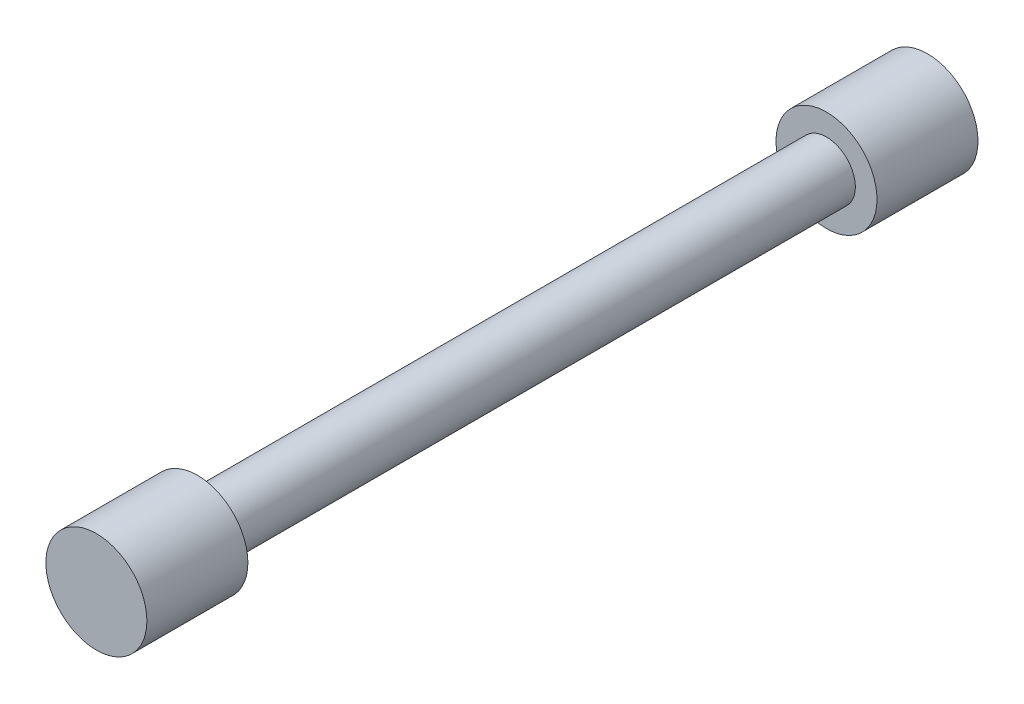
from build123d import *


with BuildPart() as part:
    # SK_Rod → Rod_Body (revolve)
    with BuildSketch(Plane(origin=(0, 0, 0), x_dir=(1, 0, 0), z_dir=(0, 1, 0))):
        Polygon((0, -7), (7, -7), (7, 7), (4, 7), (4, 94.212647431), (7, 94.212647431), (7, 108.212647431), (0, 108.212647431), align=None)
    revolve(axis=Axis((0, 0, 10), (0, 0, -1)))


solid = part.part
